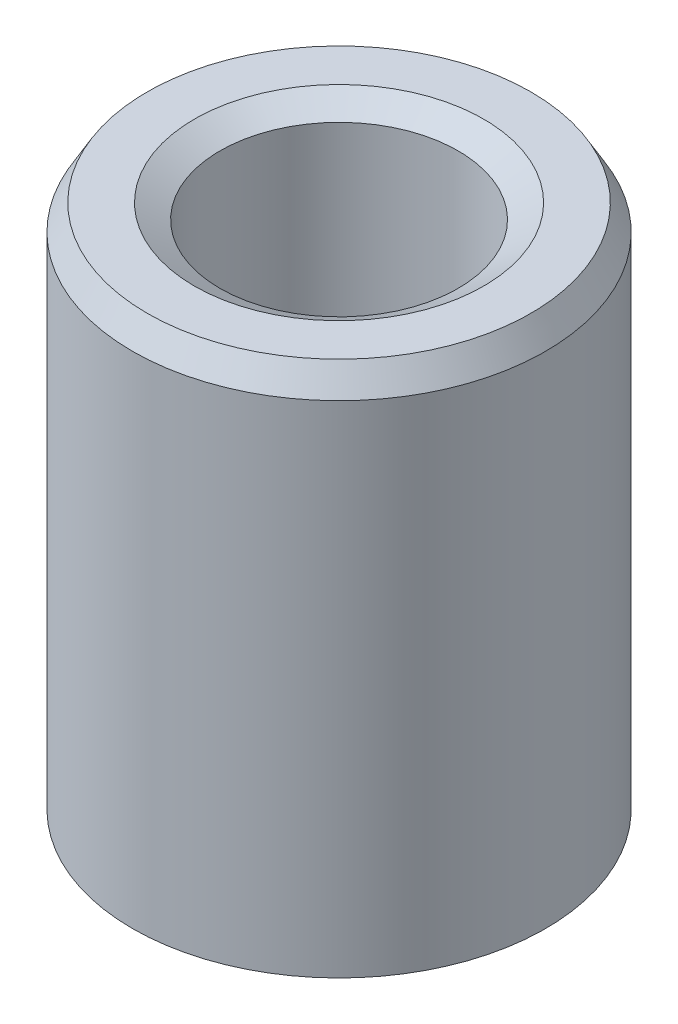
from build123d import *
from OCP.BRepFilletAPI import BRepFilletAPI_MakeChamfer

# Parameters (mm, degrees)
SKETCH1_R           = 27.5
BOSS_EXTRUDE1_DEPTH = 71.917842038
SKETCH2_R           = 15.861251514
CUT_EXTRUDE1_DEPTH  = 82.759867927
CHAMFER1_SIZE       = 3.397414957
CHAMFER1_SIZE2      = 1.96149844


with BuildPart() as part:
    # Sketch1 → Boss-Extrude1 (new body)
    with BuildSketch(Plane(origin=(0, 0, 0), x_dir=(1, 0, 0), z_dir=(0, 1, 0))):
        Circle(SKETCH1_R)
    extrude(amount=BOSS_EXTRUDE1_DEPTH)

    # Sketch2 → Cut-Extrude1 (cut, through all)
    with BuildSketch(Plane(origin=(0, 0, 0), x_dir=(1, 0, 0), z_dir=(0, 1, 0))):
        Circle(SKETCH2_R)
    extrude(amount=CUT_EXTRUDE1_DEPTH, mode=Mode.SUBTRACT)

    # Chamfer1: one chamfer whose edges measure the first distance from different faces: ONE call of the kernel's chamfer builder (chamfer() names one face for all edges)
    chamfer1_edges_1 = [part.edges().sort_by_distance(p)[0] for p in [
        (-15.861251514, 71.917842038, 0),
    ]]
    chamfer1_side_1 = [part.faces().sort_by_distance(p)[0] for p in [
        (-26.722182541, 71.917842038, 0),
    ]]
    chamfer1_edges_2 = [part.edges().sort_by_distance(p)[0] for p in [
        (-15.861251514, 0, 0),
    ]]
    chamfer1_side_2 = [part.faces().sort_by_distance(p)[0] for p in [
        (-15.861251514, 35.958921019, 0),
    ]]
    chamfer1_edges_3 = [part.edges().sort_by_distance(p)[0] for p in [
        (-27.5, 0, 0),
    ]]
    chamfer1_side_3 = [part.faces().sort_by_distance(p)[0] for p in [
        (-26.722182541, 0, 0),
    ]]
    chamfer1_edges_4 = [part.edges().sort_by_distance(p)[0] for p in [
        (-27.5, 71.917842038, 0),
    ]]
    chamfer1_side_4 = [part.faces().sort_by_distance(p)[0] for p in [
        (-27.5, 35.958921019, 0),
    ]]
    chamfer1 = BRepFilletAPI_MakeChamfer(part.part.solid().wrapped)
    for e in chamfer1_edges_1:
        chamfer1.Add(CHAMFER1_SIZE, CHAMFER1_SIZE2, e.wrapped, chamfer1_side_1[0].wrapped)  # the first distance lies on this face
    for e in chamfer1_edges_2:
        chamfer1.Add(CHAMFER1_SIZE, CHAMFER1_SIZE2, e.wrapped, chamfer1_side_2[0].wrapped)  # the first distance lies on this face
    for e in chamfer1_edges_3:
        chamfer1.Add(CHAMFER1_SIZE, CHAMFER1_SIZE2, e.wrapped, chamfer1_side_3[0].wrapped)  # the first distance lies on this face
    for e in chamfer1_edges_4:
        chamfer1.Add(CHAMFER1_SIZE, CHAMFER1_SIZE2, e.wrapped, chamfer1_side_4[0].wrapped)  # the first distance lies on this face
    add(Compound.cast(chamfer1.Shape()), mode=Mode.REPLACE)


solid = part.part
